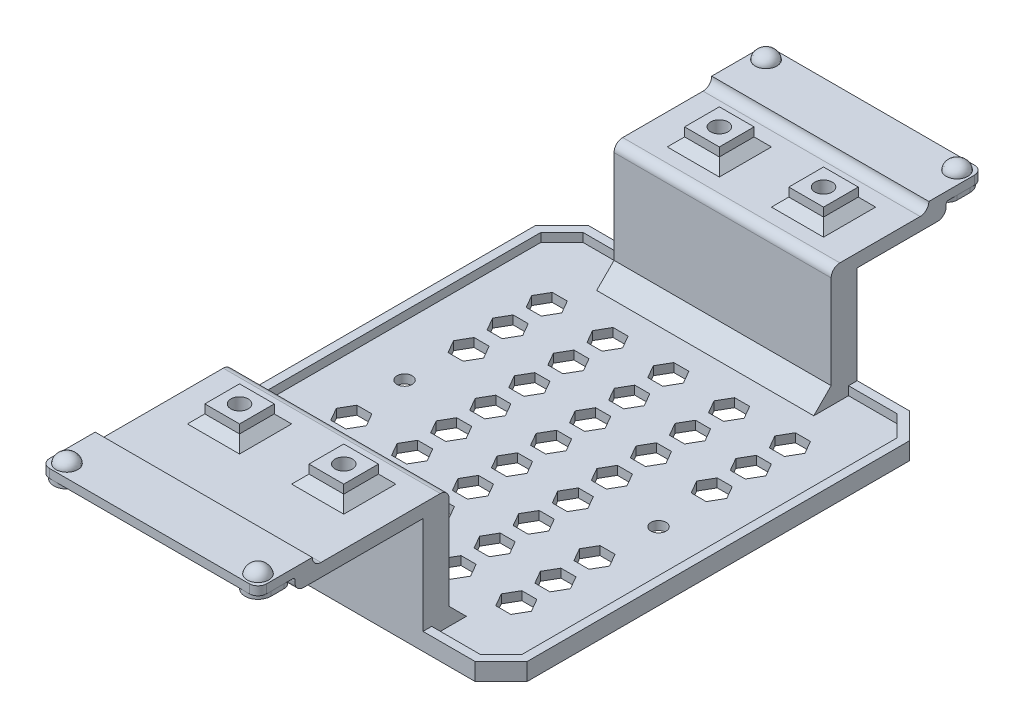
from build123d import *

# Parameters (mm, degrees)
SKETCH1_R                       = 2.5
BOSS_EXTRUDE2_DEPTH             = 1
SKETCH1_4_R                     = 2.5
BOSS_EXTRUDE3_DEPTH             = 2
DOME1_FACE_RADIUS               = 2.5
DOME1_HEIGHT                    = 2
DOME2_FACE_RADIUS               = 2.5
DOME2_HEIGHT                    = 2
DOME3_FACE_RADIUS               = 2.5
DOME3_HEIGHT                    = 2
DOME4_FACE_RADIUS               = 2.5
DOME4_HEIGHT                    = 2
FILLET1_R                       = 2
FILLET2_R                       = 2
BOSS_EXTRUDE4_DEPTH             = 2
BOSS_EXTRUDE5_START             = 2
BOSS_EXTRUDE5_DEPTH             = 2
CUT_EXTRUDE3_DEPTH              = 2
BOSS_EXTRUDE8_REACH             = 100.445
BOSS_EXTRUDE8_DIRECTION_2_REACH = 100.445
FILLET3_R                       = 2
CUT_EXTRUDE2_START              = -2
SKETCH6_R                       = 2.5
CUT_EXTRUDE2_DEPTH              = 2
FILLET5_R                       = 0.5
BOSS_EXTRUDE9_START             = -4
SKETCH8_W                       = 8
SKETCH8_H                       = 8
BOSS_EXTRUDE9_DEPTH             = 8
SKETCH9_R                       = 2
CUT_EXTRUDE4_DEPTH              = 5
CHAMFER2_SIZE                   = 2
CHAMFER3_SIZE                   = 1
SKETCH10_R                      = 1.75
CUT_EXTRUDE5_DEPTH              = 2


with BuildPart() as part:
    # Sketch1 → Boss-Extrude2 (new body)
    # profile 1 of 6: a face of its own
    with BuildSketch(Plane(origin=(0, 0, 0), x_dir=(1, 0, 0), z_dir=(0, 1, 0))):
        with BuildLine():
            ThreePointArc((25, -80.5), (22.507305936, -83.456795679), (19.171572875, -81.5))
            Line((19.171572875, -81.5), (-19.171572875, -81.5))
            ThreePointArc((-19.171572875, -81.5), (-22.507305936, -83.456795679), (-25, -80.5))
            Line((-25, -80.5), (-25, -75.5))
            Line((-25, -75.5), (25, -75.5))
            Line((25, -75.5), (25, -80.5))
        make_face()
        with Locations((22, -80.5)):
            Circle(SKETCH1_R, mode=Mode.SUBTRACT)
        with Locations((-22, -80.5)):
            Circle(SKETCH1_R, mode=Mode.SUBTRACT)
    # profile 2 of 6: a face of its own
    with BuildSketch(Plane(origin=(0, 0, 0), x_dir=(1, 0, 0), z_dir=(0, 1, 0))):
        with Locations((-22, -80.5)):
            Circle(SKETCH1_R)
    # profile 3 of 6: a face of its own
    with BuildSketch(Plane(origin=(0, 0, 0), x_dir=(1, 0, 0), z_dir=(0, 1, 0))):
        with Locations((22, -80.5)):
            Circle(SKETCH1_R)
    # profile 4 of 6: a face of its own
    with BuildSketch(Plane(origin=(0, 0, 0), x_dir=(1, 0, 0), z_dir=(0, 1, 0))):
        with BuildLine():
            Line((25, 75.5), (25, 80.5))
            ThreePointArc((25, 80.5), (22.507305936, 83.456795679), (19.171572875, 81.5))
            Line((19.171572875, 81.5), (-19.171572875, 81.5))
            ThreePointArc((-19.171572875, 81.5), (-22.507305936, 83.456795679), (-25, 80.5))
            Line((-25, 80.5), (-25, 75.5))
            Line((-25, 75.5), (25, 75.5))
        make_face()
        with Locations((-22, 80.5)):
            Circle(SKETCH1_R, mode=Mode.SUBTRACT)
        with Locations((22, 80.5)):
            Circle(SKETCH1_R, mode=Mode.SUBTRACT)
    # profile 5 of 6: a face of its own
    with BuildSketch(Plane(origin=(0, 0, 0), x_dir=(1, 0, 0), z_dir=(0, 1, 0))):
        with Locations((22, 80.5)):
            Circle(SKETCH1_R)
    # profile 6 of 6: a face of its own
    with BuildSketch(Plane(origin=(0, 0, 0), x_dir=(1, 0, 0), z_dir=(0, 1, 0))):
        with Locations((-22, 80.5)):
            Circle(SKETCH1_R)
    extrude(amount=-BOSS_EXTRUDE2_DEPTH)

    # Sketch1<4> → Boss-Extrude3 (add)
    with BuildSketch(Plane(origin=(0, 0, 0), x_dir=(1, 0, 0), z_dir=(0, 1, 0))):
        with Locations(Location((22, -80.5, 0), (0, 0, 270))):
            Circle(SKETCH1_4_R)
        with Locations(Location((-22, -80.5, 0), (0, 0, 270))):
            Circle(SKETCH1_4_R)
        with Locations(Location((22, 80.5, 0), (0, 0, 270))):
            Circle(SKETCH1_4_R)
        with Locations(Location((-22, 80.5, 0), (0, 0, 270))):
            Circle(SKETCH1_4_R)
    extrude(amount=BOSS_EXTRUDE3_DEPTH)

    # Dome1: a dome of height H over a round flat face of radius A is a cap of a sphere of radius (A * A + H * H) / (2 * H)
    dome1_r = (DOME1_FACE_RADIUS * DOME1_FACE_RADIUS + DOME1_HEIGHT * DOME1_HEIGHT) / (2 * DOME1_HEIGHT)
    dome1_base = Plane((22, 2, 80.5), z_dir=(0, 1, 0))
    with Locations(dome1_base.offset(DOME1_HEIGHT - dome1_r)):
        dome1_ball = Sphere(dome1_r, mode=Mode.PRIVATE)
    add(split(dome1_ball, bisect_by=dome1_base, keep=Keep.TOP, mode=Mode.PRIVATE))

    # Dome2: an elliptical dome of height H over a round flat face of radius A is half a spheroid: the quarter ellipse of half axes A and H revolved about the face's axis
    with BuildSketch(Plane((22, 2, -80.5), x_dir=(0, 0, -1), z_dir=(1, 0, 0)), mode=Mode.PRIVATE) as dome2_quarter:
        Ellipse(DOME2_FACE_RADIUS, DOME2_HEIGHT)
        Rectangle(DOME2_FACE_RADIUS, DOME2_HEIGHT, align=(Align.MIN, Align.MIN), mode=Mode.INTERSECT)
    revolve(dome2_quarter.sketch, axis=Axis((22, 2, -80.5), (0, 1, 0)))

    # Dome3: an elliptical dome of height H over a round flat face of radius A is half a spheroid: the quarter ellipse of half axes A and H revolved about the face's axis
    with BuildSketch(Plane((-22, 2, -80.5), x_dir=(0, 0, -1), z_dir=(1, 0, 0)), mode=Mode.PRIVATE) as dome3_quarter:
        Ellipse(DOME3_FACE_RADIUS, DOME3_HEIGHT)
        Rectangle(DOME3_FACE_RADIUS, DOME3_HEIGHT, align=(Align.MIN, Align.MIN), mode=Mode.INTERSECT)
    revolve(dome3_quarter.sketch, axis=Axis((-22, 2, -80.5), (0, 1, 0)))

    # Dome4: an elliptical dome of height H over a round flat face of radius A is half a spheroid: the quarter ellipse of half axes A and H revolved about the face's axis
    with BuildSketch(Plane((-22, 2, 80.5), x_dir=(0, 0, -1), z_dir=(1, 0, 0)), mode=Mode.PRIVATE) as dome4_quarter:
        Ellipse(DOME4_FACE_RADIUS, DOME4_HEIGHT)
        Rectangle(DOME4_FACE_RADIUS, DOME4_HEIGHT, align=(Align.MIN, Align.MIN), mode=Mode.INTERSECT)
    revolve(dome4_quarter.sketch, axis=Axis((-22, 2, 80.5), (0, 1, 0)))

    # Fillet1
    fillet1_edges = [part.edges().sort_by_distance(p)[0] for p in [
        (25, -0.5, -75.5),
        (-25, -0.5, -75.5),
    ]]
    fillet(fillet1_edges, radius=FILLET1_R)

    # Fillet2
    fillet2_edges = [part.edges().sort_by_distance(p)[0] for p in [
        (-25, -0.5, 75.5),
        (25, -0.5, 75.5),
    ]]
    fillet(fillet2_edges, radius=FILLET2_R)


with BuildPart() as body_2:
    # Sketch2 → Boss-Extrude4 (new body)
    with BuildSketch(Plane(origin=(0, -29.5, 0), x_dir=(1, 0, 0), z_dir=(0, 1, 0))):
        Polygon((-37, -45.5), (37, -45.5), (43, -39.5), (43, 48.5), (37, 54.5), (-37, 54.5), (-43, 48.5), (-43, -39.5), align=None)
    extrude(amount=BOSS_EXTRUDE4_DEPTH)

    # Sketch2<3> → Boss-Extrude5 (add)
    with BuildSketch(Plane(origin=(0, -29.5, 0), x_dir=(1, 0, 0), z_dir=(0, 1, 0)).offset(BOSS_EXTRUDE5_START)):
        Polygon((-43, 48.5), (-37, 54.5), (37, 54.5), (43, 48.5), (43, -39.5), (37, -45.5), (-37, -45.5), (-43, -39.5), align=None)
        Polygon((-41, -38.671572875), (-36.171572875, -43.5), (36.171572875, -43.5), (41, -38.671572875), (41, 47.671572875), (36.171572875, 52.5), (-36.171572875, 52.5), (-41, 47.671572875), align=None, mode=Mode.SUBTRACT)
    extrude(amount=BOSS_EXTRUDE5_DEPTH)

    # Sketch7 → Cut-Extrude3 (cut)
    with BuildSketch(Plane(origin=(0, -27.5, 0), x_dir=(1, 0, 0), z_dir=(0, 1, 0))):
        Polygon((17.464101615, 0), (15.732050808, 3), (12.267949192, 3), (10.535898385, 0), (12.267949192, -3), (15.732050808, -3), align=None)
        Polygon((3.464101615, 0), (1.732050808, 3), (-1.732050808, 3), (-3.464101615, 0), (-1.732050808, -3), (1.732050808, -3), align=None)
        Polygon((17.464101615, 9), (15.732050808, 12), (12.267949192, 12), (10.535898385, 9), (12.267949192, 6), (15.732050808, 6), align=None)
        Polygon((17.464101615, 18), (15.732050808, 21), (12.267949192, 21), (10.535898385, 18), (12.267949192, 15), (15.732050808, 15), align=None)
        Polygon((31.464101615, 18), (29.732050808, 21), (26.267949192, 21), (24.535898385, 18), (26.267949192, 15), (29.732050808, 15), align=None)
        Polygon((17.464101615, 27), (15.732050808, 30), (12.267949192, 30), (10.535898385, 27), (12.267949192, 24), (15.732050808, 24), align=None)
        Polygon((31.464101615, 27), (29.732050808, 30), (26.267949192, 30), (24.535898385, 27), (26.267949192, 24), (29.732050808, 24), align=None)
        Polygon((17.464101615, 36), (15.732050808, 39), (12.267949192, 39), (10.535898385, 36), (12.267949192, 33), (15.732050808, 33), align=None)
        Polygon((31.464101615, 36), (29.732050808, 39), (26.267949192, 39), (24.535898385, 36), (26.267949192, 33), (29.732050808, 33), align=None)
        Polygon((3.464101615, 9), (1.732050808, 12), (-1.732050808, 12), (-3.464101615, 9), (-1.732050808, 6), (1.732050808, 6), align=None)
        Polygon((3.464101615, 18), (1.732050808, 21), (-1.732050808, 21), (-3.464101615, 18), (-1.732050808, 15), (1.732050808, 15), align=None)
        Polygon((3.464101615, 27), (1.732050808, 30), (-1.732050808, 30), (-3.464101615, 27), (-1.732050808, 24), (1.732050808, 24), align=None)
        Polygon((3.464101615, 36), (1.732050808, 39), (-1.732050808, 39), (-3.464101615, 36), (-1.732050808, 33), (1.732050808, 33), align=None)
        Polygon((3.464101615, -9), (1.732050808, -6), (-1.732050808, -6), (-3.464101615, -9), (-1.732050808, -12), (1.732050808, -12), align=None)
        Polygon((17.464101615, -9), (15.732050808, -6), (12.267949192, -6), (10.535898385, -9), (12.267949192, -12), (15.732050808, -12), align=None)
        Polygon((31.464101615, -9), (29.732050808, -6), (26.267949192, -6), (24.535898385, -9), (26.267949192, -12), (29.732050808, -12), align=None)
        Polygon((3.464101615, -18), (1.732050808, -15), (-1.732050808, -15), (-3.464101615, -18), (-1.732050808, -21), (1.732050808, -21), align=None)
        Polygon((17.464101615, -18), (15.732050808, -15), (12.267949192, -15), (10.535898385, -18), (12.267949192, -21), (15.732050808, -21), align=None)
        Polygon((31.464101615, -18), (29.732050808, -15), (26.267949192, -15), (24.535898385, -18), (26.267949192, -21), (29.732050808, -21), align=None)
        Polygon((3.464101615, -27), (1.732050808, -24), (-1.732050808, -24), (-3.464101615, -27), (-1.732050808, -30), (1.732050808, -30), align=None)
        Polygon((17.464101615, -27), (15.732050808, -24), (12.267949192, -24), (10.535898385, -27), (12.267949192, -30), (15.732050808, -30), align=None)
        Polygon((31.464101615, -27), (29.732050808, -24), (26.267949192, -24), (24.535898385, -27), (26.267949192, -30), (29.732050808, -30), align=None)
        Polygon((-29.732050808, -30), (-31.464101615, -27), (-29.732050808, -24), (-26.267949192, -24), (-24.535898385, -27), (-26.267949192, -30), align=None)
        Polygon((-15.732050808, -30), (-17.464101615, -27), (-15.732050808, -24), (-12.267949192, -24), (-10.535898385, -27), (-12.267949192, -30), align=None)
        Polygon((-29.732050808, -21), (-31.464101615, -18), (-29.732050808, -15), (-26.267949192, -15), (-24.535898385, -18), (-26.267949192, -21), align=None)
        Polygon((-15.732050808, -21), (-17.464101615, -18), (-15.732050808, -15), (-12.267949192, -15), (-10.535898385, -18), (-12.267949192, -21), align=None)
        Polygon((-29.732050808, -12), (-31.464101615, -9), (-29.732050808, -6), (-26.267949192, -6), (-24.535898385, -9), (-26.267949192, -12), align=None)
        Polygon((-15.732050808, -12), (-17.464101615, -9), (-15.732050808, -6), (-12.267949192, -6), (-10.535898385, -9), (-12.267949192, -12), align=None)
        Polygon((-29.732050808, 33), (-31.464101615, 36), (-29.732050808, 39), (-26.267949192, 39), (-24.535898385, 36), (-26.267949192, 33), align=None)
        Polygon((-15.732050808, 33), (-17.464101615, 36), (-15.732050808, 39), (-12.267949192, 39), (-10.535898385, 36), (-12.267949192, 33), align=None)
        Polygon((-29.732050808, 24), (-31.464101615, 27), (-29.732050808, 30), (-26.267949192, 30), (-24.535898385, 27), (-26.267949192, 24), align=None)
        Polygon((-15.732050808, 24), (-17.464101615, 27), (-15.732050808, 30), (-12.267949192, 30), (-10.535898385, 27), (-12.267949192, 24), align=None)
        Polygon((-29.732050808, 15), (-31.464101615, 18), (-29.732050808, 21), (-26.267949192, 21), (-24.535898385, 18), (-26.267949192, 15), align=None)
        Polygon((-15.732050808, 15), (-17.464101615, 18), (-15.732050808, 21), (-12.267949192, 21), (-10.535898385, 18), (-12.267949192, 15), align=None)
        Polygon((-15.732050808, 6), (-17.464101615, 9), (-15.732050808, 12), (-12.267949192, 12), (-10.535898385, 9), (-12.267949192, 6), align=None)
        Polygon((-15.732050808, -3), (-17.464101615, 0), (-15.732050808, 3), (-12.267949192, 3), (-10.535898385, 0), (-12.267949192, -3), align=None)
    extrude(amount=-CUT_EXTRUDE3_DEPTH, mode=Mode.SUBTRACT)


    # Boss-Extrude8: up to this face of the body (flat: up to its plane)
    boss_extrude8_end = Plane(part.part.faces().sort_by_distance((25, -0.5, 79))[0])
    # Sketch5 → Boss-Extrude8 (add, up to the picked face)
    with BuildSketch(Plane(origin=(0, 0, 0), x_dir=(0, 0, -1), z_dir=(1, 0, 0)), mode=Mode.PRIVATE) as boss_extrude8_sk1:
        Polygon((-39.5, -23.5), (-39.5, 0), (-71, 0), (-71, 2), (-83.5, 2), (-83.5, 0), (-75, 0), (-75, -3), (-45.5, -3), (-45.5, -29.5), (-39.5, -29.5), (-33.5, -29.5), align=None)
    boss_extrude8_tool1 = split(extrude(boss_extrude8_sk1.sketch, amount=BOSS_EXTRUDE8_REACH, mode=Mode.PRIVATE), bisect_by=boss_extrude8_end, keep=Keep.BOTH, mode=Mode.PRIVATE)
    # Sketch5 → Boss-Extrude8 (add, up to the picked face)
    with BuildSketch(Plane(origin=(0, 0, 0), x_dir=(0, 0, -1), z_dir=(1, 0, 0)), mode=Mode.PRIVATE) as boss_extrude8_sk2:
        Polygon((48.5, -23.5), (48.5, 0), (71, 0), (71, 2), (83.5, 2), (83.5, 0), (75, 0), (75, -3), (54.5, -3), (54.5, -29.5), (48.5, -29.5), (42.5, -29.5), align=None)
    boss_extrude8_tool2 = split(extrude(boss_extrude8_sk2.sketch, amount=BOSS_EXTRUDE8_REACH, mode=Mode.PRIVATE), bisect_by=boss_extrude8_end, keep=Keep.BOTH, mode=Mode.PRIVATE)
    add(boss_extrude8_tool1.solids().sort_by(Axis((0, -11.75, 40.090953), (1, 0, 0)))[0])
    add(boss_extrude8_tool2.solids().sort_by(Axis((0, -11.75, -49.017035), (1, 0, 0)))[0])


    # Boss-Extrude8 direction 2: up to this face of the body (flat: up to its plane)
    boss_extrude8_direction_2_end = Plane(part.part.faces().sort_by_distance((-25, -0.5, 79))[0])
    # Sketch5 → Boss-Extrude8 direction 2 (add, up to the picked face)
    with BuildSketch(Plane(origin=(0, 0, 0), x_dir=(0, 0, -1), z_dir=(1, 0, 0)), mode=Mode.PRIVATE) as boss_extrude8_direction_2_sk1:
        Polygon((-39.5, -23.5), (-39.5, 0), (-71, 0), (-71, 2), (-83.5, 2), (-83.5, 0), (-75, 0), (-75, -3), (-45.5, -3), (-45.5, -29.5), (-39.5, -29.5), (-33.5, -29.5), align=None)
    boss_extrude8_direction_2_tool1 = split(extrude(boss_extrude8_direction_2_sk1.sketch, amount=-BOSS_EXTRUDE8_DIRECTION_2_REACH, mode=Mode.PRIVATE), bisect_by=boss_extrude8_direction_2_end, keep=Keep.BOTH, mode=Mode.PRIVATE)
    # Sketch5 → Boss-Extrude8 direction 2 (add, up to the picked face)
    with BuildSketch(Plane(origin=(0, 0, 0), x_dir=(0, 0, -1), z_dir=(1, 0, 0)), mode=Mode.PRIVATE) as boss_extrude8_direction_2_sk2:
        Polygon((48.5, -23.5), (48.5, 0), (71, 0), (71, 2), (83.5, 2), (83.5, 0), (75, 0), (75, -3), (54.5, -3), (54.5, -29.5), (48.5, -29.5), (42.5, -29.5), align=None)
    boss_extrude8_direction_2_tool2 = split(extrude(boss_extrude8_direction_2_sk2.sketch, amount=-BOSS_EXTRUDE8_DIRECTION_2_REACH, mode=Mode.PRIVATE), bisect_by=boss_extrude8_direction_2_end, keep=Keep.BOTH, mode=Mode.PRIVATE)
    add(boss_extrude8_direction_2_tool1.solids().sort_by(Axis((0, -11.75, 40.090953), (-1, 0, 0)))[0])
    add(boss_extrude8_direction_2_tool2.solids().sort_by(Axis((0, -11.75, -49.017035), (-1, 0, 0)))[0])

    # Fillet3
    fillet3_edges = [body_2.edges().sort_by_distance(p)[0] for p in [
        (-25, 1, 83.5),
        (25, 1, 83.5),
        (0, 0, -71),
        (0, 0, -48.5),
        (0, 0, 71),
        (0, 0, 39.5),
        (-25, 1, -83.5),
        (25, 1, -83.5),
        (0, -3, 75),
        (0, -3, -75),
    ]]
    fillet(fillet3_edges, radius=FILLET3_R - 0.0001)  # a hair under: the kernel refuses the full size

    # Sketch6 → Cut-Extrude2 (cut)
    with BuildSketch(Plane(origin=(0, 2, 0), x_dir=(1, 0, 0), z_dir=(0, 1, 0)).offset(CUT_EXTRUDE2_START)):
        with Locations(Location((-22, -80.5, 0), (0, 0, 270))):
            Circle(SKETCH6_R)
        with Locations(Location((22, -80.5, 0), (0, 0, 270))):
            Circle(SKETCH6_R)
        with Locations(Location((22, 80.5, 0), (0, 0, 270))):
            Circle(SKETCH6_R)
        with Locations(Location((-22, 80.5, 0), (0, 0, 270))):
            Circle(SKETCH6_R)
    extrude(amount=CUT_EXTRUDE2_DEPTH, mode=Mode.SUBTRACT)

    # Fillet5
    fillet5_edges = [body_2.edges().sort_by_distance(p)[0] for p in [
        (0, 0, 75),
        (0, 0, -75),
    ]]
    fillet(fillet5_edges, radius=FILLET5_R)

    # Sketch8 → Boss-Extrude9 (add)
    with BuildSketch(Plane(origin=(0, 0, 0), x_dir=(1, 0, 0), z_dir=(0, 1, 0)).offset(BOSS_EXTRUDE9_START)):
        with Locations((12, 59.75)):
            Rectangle(SKETCH8_W, SKETCH8_H)
        with Locations((-12, 59.75)):
            Rectangle(SKETCH8_W, SKETCH8_H)
        with Locations((-12, -50.75)):
            Rectangle(SKETCH8_W, SKETCH8_H)
        with Locations((12, -50.75)):
            Rectangle(SKETCH8_W, SKETCH8_H)
    extrude(amount=BOSS_EXTRUDE9_DEPTH)

    # Sketch9 → Cut-Extrude4 (cut)
    with BuildSketch(Plane(origin=(0, 4, 0), x_dir=(1, 0, 0), z_dir=(0, 1, 0))):
        with Locations(Location((-12, 59.75, 0), (0, 0, 270))):
            Circle(SKETCH9_R)
        with Locations(Location((12, 59.75, 0), (0, 0, 270))):
            Circle(SKETCH9_R)
        with Locations(Location((12, -50.75, 0), (0, 0, 90))):
            Circle(SKETCH9_R)
        with Locations(Location((-12, -50.75, 0), (0, 0, 90))):
            Circle(SKETCH9_R)
    extrude(amount=-CUT_EXTRUDE4_DEPTH, mode=Mode.SUBTRACT)

    # Chamfer2
    chamfer2_edges = [body_2.edges().sort_by_distance(p)[0] for p in [
        (-12, 0, 46.75),
        (-8, 0, 50.75),
        (-12, 0, 54.75),
        (-16, 0, 50.75),
        (12, 0, 46.75),
        (16, 0, 50.75),
        (12, 0, 54.75),
        (8, 0, 50.75),
        (-8, 0, -59.75),
        (-12, 0, -63.75),
        (-16, 0, -59.75),
        (-12, 0, -55.75),
        (16, 0, -59.75),
        (12, 0, -63.75),
        (8, 0, -59.75),
        (12, 0, -55.75),
    ]]
    chamfer(chamfer2_edges, length=CHAMFER2_SIZE)

    # Chamfer3
    chamfer3_edges = [body_2.edges().sort_by_distance(p)[0] for p in [
        (12, -3, -63.75),
        (8, -3, -59.75),
        (16, -3, -59.75),
        (12, -3, -55.75),
        (-12, -3, -55.75),
        (-8, -3, -59.75),
        (-12, -3, -63.75),
        (-16, -3, -59.75),
        (-12, -3, 46.75),
        (-8, -3, 50.75),
        (-12, -3, 54.75),
        (-16, -3, 50.75),
        (8, -3, 50.75),
        (12, -3, 46.75),
        (12, -3, 54.75),
        (16, -3, 50.75),
    ]]
    chamfer(chamfer3_edges, length=CHAMFER3_SIZE - 0.0001)  # a hair under: the kernel refuses the full size

    # Sketch10 → Cut-Extrude5 (cut)
    with BuildSketch(Plane(origin=(0, -27.5, 0), x_dir=(1, 0, 0), z_dir=(0, 1, 0))):
        with Locations(Location((29.25, 4.5, 0), (0, 0, 270))):
            Circle(SKETCH10_R)
        with Locations(Location((-29.25, 4.5, 0), (0, 0, 270))):
            Circle(SKETCH10_R)
    extrude(amount=-CUT_EXTRUDE5_DEPTH, mode=Mode.SUBTRACT)


solid = Compound([part.part, body_2.part])
